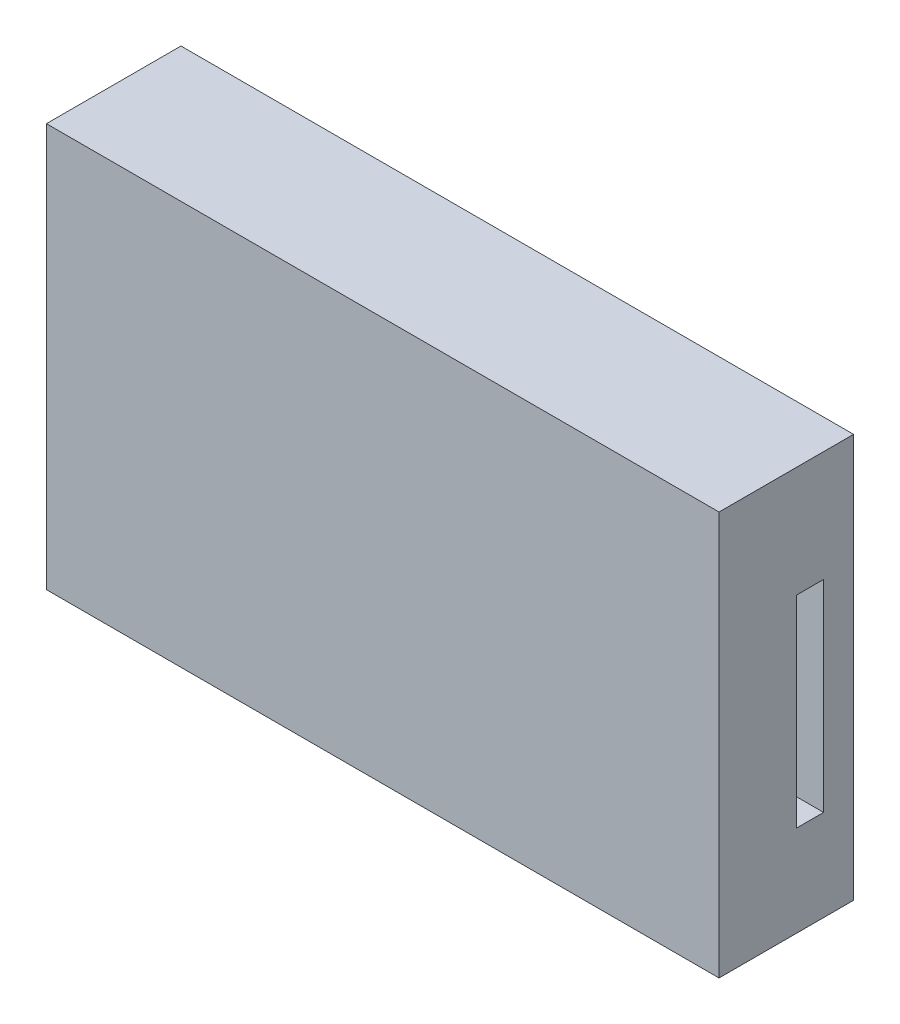
from build123d import *

# Parameters (mm, degrees)
SKETCH1_W           = 50
SKETCH1_H           = 30
BOSS_EXTRUDE1_DEPTH = 10
SHELL4_T            = -2
SKETCH9_W           = 2
SKETCH9_H           = 15
CUT_EXTRUDE5_DEPTH  = 63.649820431


with BuildPart() as part:
    # Sketch1 → Boss-Extrude1 (new body)
    with BuildSketch(Plane.XY):
        Rectangle(SKETCH1_W, SKETCH1_H)
    extrude(amount=BOSS_EXTRUDE1_DEPTH)

    # Shell4
    shell4_openings = [part.faces().sort_by_distance(p)[0] for p in [
        (0, 0, 0),
    ]]
    offset(amount=SHELL4_T, openings=shell4_openings, kind=Kind.INTERSECTION)

    # Sketch9 → Cut-Extrude5 (cut, through all)
    with BuildSketch(Plane(origin=(35, 0, 0), x_dir=(0, 0, -1), z_dir=(1, 0, 0))):
        with Locations((-3.225993387, -0.726962262)):
            Rectangle(SKETCH9_W, SKETCH9_H)
    extrude(amount=-CUT_EXTRUDE5_DEPTH, mode=Mode.SUBTRACT)


solid = part.part
